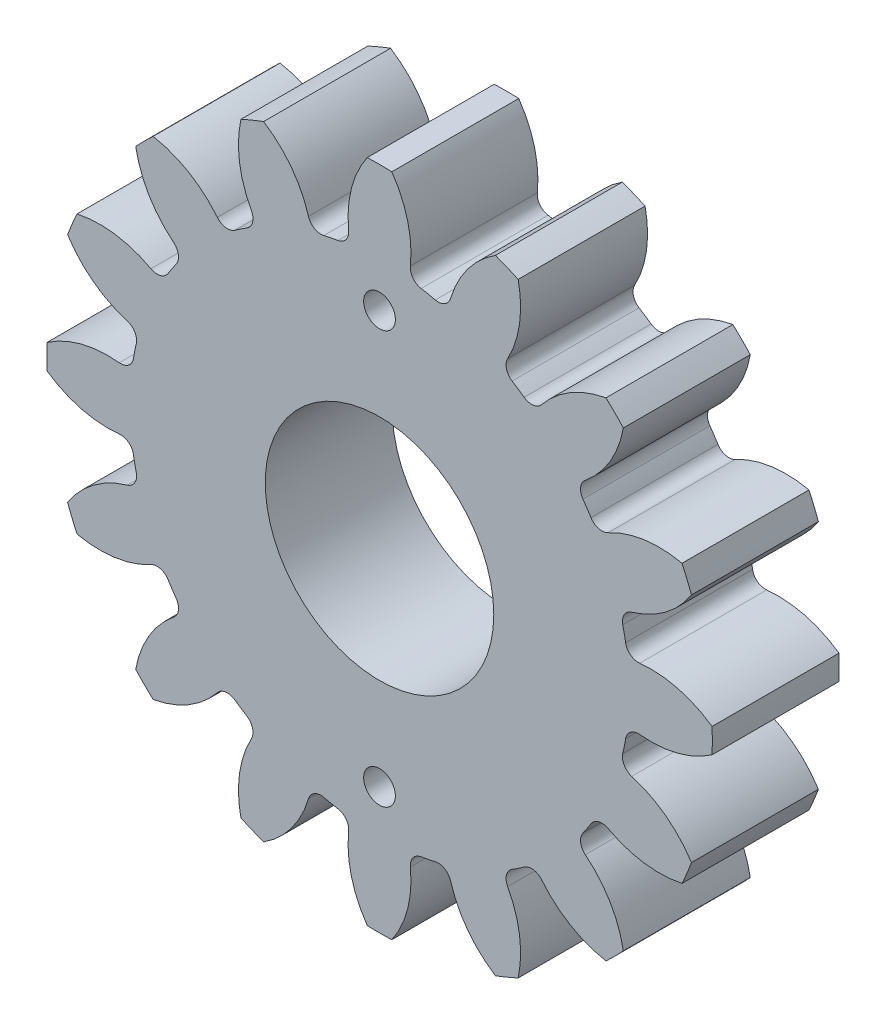
from build123d import *

# Parameters (mm, degrees)
ESQUISSE1_R                        = 1.15
BASE_EXTRUSION_DEPTH               = 2.5
BOSS_EXTRU_1_DEPTH                 = 4
CONG_1_R                           = 0.40775
R_P_TITION_CIRCULAIRE4_COUNT       = 16
CONG_1_OF_R_P_TITION_CIRCULAIRE4_R = 0.40775
ESQUISSE8_R                        = 3.6
ENL_V_MAT_EXTRU_1_DEPTH            = 16.358074586
ESQUISSE9_R                        = 0.5
ENL_V_MAT_EXTRU_2_DEPTH            = 16.358074586


with BuildPart() as part:
    # Esquisse1 → Base-Extrusion (new body)
    with BuildSketch(Plane.XY):
        Circle(ESQUISSE1_R)
    extrude(amount=BASE_EXTRUSION_DEPTH)

    # Esquisse3 → Boss.-Extru.1 (add)
    with BuildSketch(Plane.XY):
        with BuildLine():
            Line((-1.53414152, 7.712650249), (0, 0))
            Line((0, 0), (1.53414152, 7.712650249))
            ThreePointArc((1.53414152, 7.712650249), (1.222047708, 7.768214947), (0.907968022, 7.811156005))
            ThreePointArc((0.907968022, 7.811156005), (0.929201465, 9.199391503), (0.387682352, 10.477830281))
            ThreePointArc((0.387682352, 10.477830281), (0, 10.485), (-0.387682352, 10.477830281))
            ThreePointArc((-0.387682352, 10.477830281), (-0.929201465, 9.199391503), (-0.907968022, 7.811156005))
            ThreePointArc((-0.907968022, 7.811156005), (-1.222047708, 7.768214947), (-1.53414152, 7.712650249))
        make_face()
    boss_extru_1 = extrude(amount=BOSS_EXTRU_1_DEPTH)

    # Congé1
    cong_1_edges = [part.edges().sort_by_distance(p)[0] for p in [
        (0.907968022, 7.811156005, 2),
        (-0.907968022, 7.811156005, 2),
    ]]
    fillet(cong_1_edges, radius=CONG_1_R)

    # Répétition circulaire4: Boss.-Extru.1 ×16 about axis
    r_p_tition_circulaire4_axis = Axis((0, 0, 54), (0, 0, -1))
    for i in range(1, R_P_TITION_CIRCULAIRE4_COUNT):
        add(boss_extru_1.rotate(r_p_tition_circulaire4_axis, i * 360 / R_P_TITION_CIRCULAIRE4_COUNT))

    # Congé1 of Répétition circulaire4
    cong_1_of_r_p_tition_circulaire4_edges = [part.edges().sort_by_distance(p)[0] for p in [
        (3.828053063, 6.869102839, 2),
        (2.150346919, 7.564031477, 2),
        (6.165351726, 4.881291034, 2),
        (4.881291034, 6.165351726, 2),
        (7.564031477, 2.150346919, 2),
        (6.869102839, 3.828053063, 2),
        (7.811156005, -0.907968022, 2),
        (7.811156005, 0.907968022, 2),
        (6.869102839, -3.828053063, 2),
        (7.564031477, -2.150346919, 2),
        (4.881291034, -6.165351726, 2),
        (6.165351726, -4.881291034, 2),
        (2.150346919, -7.564031477, 2),
        (3.828053063, -6.869102839, 2),
        (-0.907968022, -7.811156005, 2),
        (0.907968022, -7.811156005, 2),
        (-3.828053063, -6.869102839, 2),
        (-2.150346919, -7.564031477, 2),
        (-6.165351726, -4.881291034, 2),
        (-4.881291034, -6.165351726, 2),
        (-7.564031477, -2.150346919, 2),
        (-6.869102839, -3.828053063, 2),
        (-7.811156005, 0.907968022, 2),
        (-7.811156005, -0.907968022, 2),
        (-6.869102839, 3.828053063, 2),
        (-7.564031477, 2.150346919, 2),
        (-4.881291034, 6.165351726, 2),
        (-6.165351726, 4.881291034, 2),
        (-2.150346919, 7.564031477, 2),
        (-3.828053063, 6.869102839, 2),
    ]]
    fillet(cong_1_of_r_p_tition_circulaire4_edges, radius=CONG_1_OF_R_P_TITION_CIRCULAIRE4_R)

    # Esquisse8 → Enlèv. mat.-Extru.1 (cut, through all)
    with BuildSketch(Plane.XY.offset(4)):
        Circle(ESQUISSE8_R)
    extrude(amount=-ENL_V_MAT_EXTRU_1_DEPTH, mode=Mode.SUBTRACT)

    # Esquisse9 → Enlèv. mat.-Extru.2 (cut, through all)
    with BuildSketch(Plane(origin=(0, 0, 0), x_dir=(-1, 0, 0), z_dir=(0, 0, -1))):
        with Locations((0, 6.5)):
            Circle(ESQUISSE9_R)
        with Locations((0, -6.5)):
            Circle(ESQUISSE9_R)
    extrude(amount=-ENL_V_MAT_EXTRU_2_DEPTH, mode=Mode.SUBTRACT)


solid = part.part
